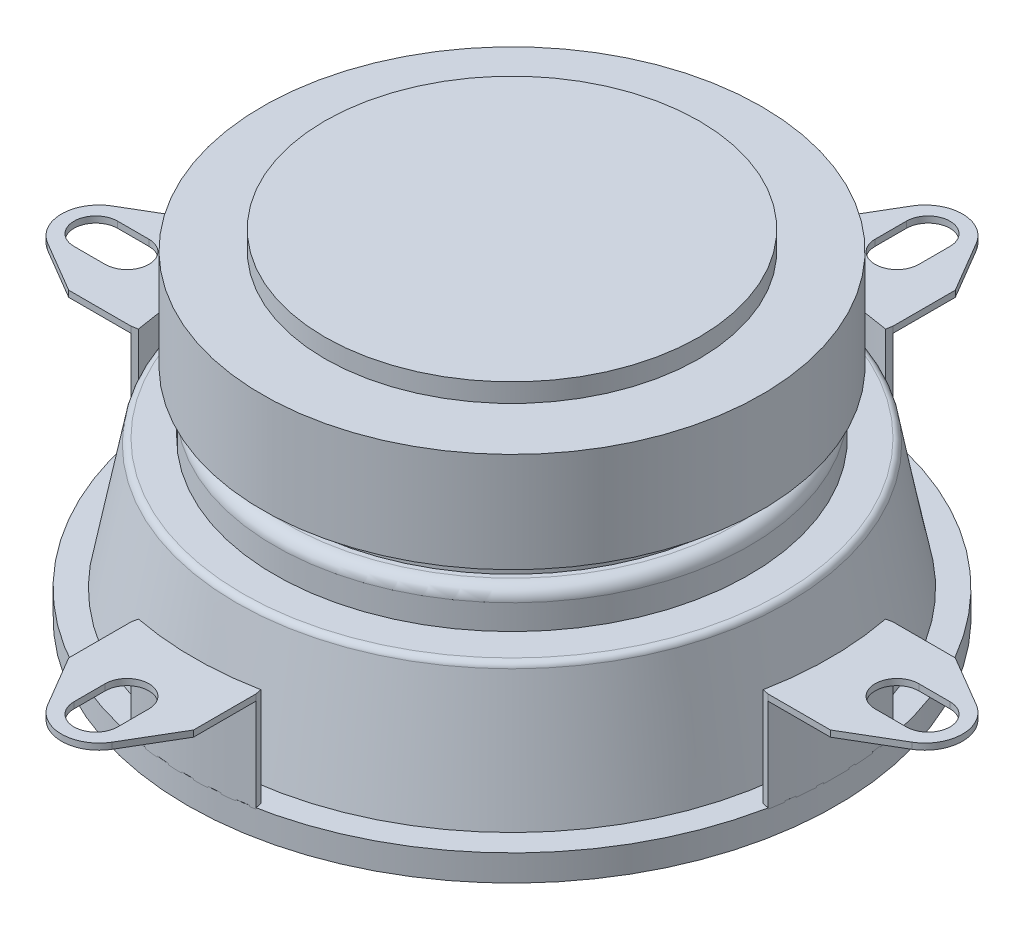
from build123d import *

# Parameters (mm, degrees)
BOSS_EXTRUDE1_START = 10
BOSS_EXTRUDE1_DEPTH = 0.5
EXTRUDE_THIN1_DEPTH = 8
CUT_EXTRUDE1_DEPTH  = 9
CIRPATTERN2_COUNT   = 4


with BuildPart() as part:
    # Sketch2 → Revolve1 (revolve)
    with BuildSketch(Plane.XY):
        with BuildLine():
            Line((26, 0), (26, 2.094374468))
            Line((26, 2.094374468), (24, 2.094374468))
            Line((24, 2.094374468), (22.077962739, 12.094374468))
            ThreePointArc((22.077962739, 12.094374468), (21.905393739, 12.385478426), (21.586950051, 12.5))
            Line((21.586950051, 12.5), (19, 12.5))
            Line((19, 12.5), (19, 14.5))
            ThreePointArc((19, 14.5), (18.707106781, 15.207106781), (18, 15.5))
            Line((18, 15.5), (17.617867849, 15.5))
            Line((17.617867849, 15.5), (17.617867849, 17.5))
            Line((17.617867849, 17.5), (20, 17.5))
            Line((20, 17.5), (20, 25.5))
            Line((20, 25.5), (15, 25.5))
            Line((15, 25.5), (15, 27))
            Line((15, 27), (0, 27))
            Line((0, 27), (0, 0))
            Line((0, 0), (26, 0))
        make_face()
    revolve(axis=Axis((0, 0, 0), (0, 1, 0)))

    # Sketch3 → Cut-Revolve1 (revolve, cut)
    with BuildSketch(Plane.XY):
        with BuildLine():
            Line((21.189393732, 3.016721836), (23.008078499, 3.016721836))
            Line((23.008078499, 3.016721836), (23.587903677, 0))
            Line((23.587903677, 0), (23.587903677, -1.369873418))
            Line((23.587903677, -1.369873418), (0, -1.005415736))
            Line((0, -1.005415736), (0, 4.959575585))
            ThreePointArc((0, 4.959575585), (8.251703257, 4.256555213), (16.265552079, 2.167758584))
            ThreePointArc((16.265552079, 2.167758584), (19.168156315, 0.036351808), (21.189393732, 3.016721836))
        make_face()
    revolve(axis=Axis((0, 0, 0), (0, 1, 0)), mode=Mode.SUBTRACT)


with BuildPart() as body_2:
    # Sketch4 → Boss-Extrude1 (new body)
    with BuildSketch(Plane(origin=(0, 0, 0), x_dir=(1, 0, 0), z_dir=(0, 1, 0)).offset(BOSS_EXTRUDE1_START)):
        with BuildLine():
            Line((-5, -25.514701644), (-5, -30.514701644))
            Line((-5, -30.514701644), (-2.584650704, -34.613693526))
            ThreePointArc((-2.584650704, -34.613693526), (0, -36.090676541), (2.584650704, -34.613693526))
            Line((2.584650704, -34.613693526), (5, -30.514701644))
            Line((5, -30.514701644), (5, -25.514701644))
            ThreePointArc((5, -25.514701644), (0, -26), (-5, -25.514701644))
        make_face()
    extrude(amount=-BOSS_EXTRUDE1_DEPTH)

    # Sketch5 → Extrude-Thin1 (add)
    with BuildSketch(Plane(origin=(0, 10, 0), x_dir=(-1, 0, 0), z_dir=(0, 1, 0))):
        with BuildLine():
            ThreePointArc((5, 25.514701644), (0, 26), (-5, 25.514701644))
            Line((-5, 25.514701644), (-4.903846154, 25.024034305))
            ThreePointArc((-4.903846154, 25.024034305), (0, 25.5), (4.903846154, 25.024034305))
            Line((4.903846154, 25.024034305), (5, 25.514701644))
        make_face()
    extrude(amount=-EXTRUDE_THIN1_DEPTH)

    # Sketch6 → Cut-Extrude1 (cut)
    with BuildSketch(Plane(origin=(0, 10, 0), x_dir=(-1, 0, 0), z_dir=(0, 1, 0))):
        with BuildLine():
            Line((-1.75, 30.840676541), (-1.75, 33.340676541))
            ThreePointArc((-1.75, 33.340676541), (0, 35.090676541), (1.75, 33.340676541))
            Line((1.75, 33.340676541), (1.75, 30.840676541))
            ThreePointArc((1.75, 30.840676541), (0, 29.090676541), (-1.75, 30.840676541))
        make_face()
    extrude(amount=-CUT_EXTRUDE1_DEPTH, mode=Mode.SUBTRACT)


with BuildPart() as cirpattern2_1:
    # CirPattern2: pattern copy
    add(body_2.part.rotate(Axis((0, 2.167758584, 0), (0, -1, 0)), 1 * 360 / CIRPATTERN2_COUNT))


with BuildPart() as cirpattern2_2:
    # CirPattern2: pattern copy
    add(body_2.part.rotate(Axis((0, 2.167758584, 0), (0, -1, 0)), 2 * 360 / CIRPATTERN2_COUNT))


with BuildPart() as cirpattern2_3:
    # CirPattern2: pattern copy
    add(body_2.part.rotate(Axis((0, 2.167758584, 0), (0, -1, 0)), 3 * 360 / CIRPATTERN2_COUNT))


solid = Compound([part.part, body_2.part, cirpattern2_1.part, cirpattern2_2.part, cirpattern2_3.part])
